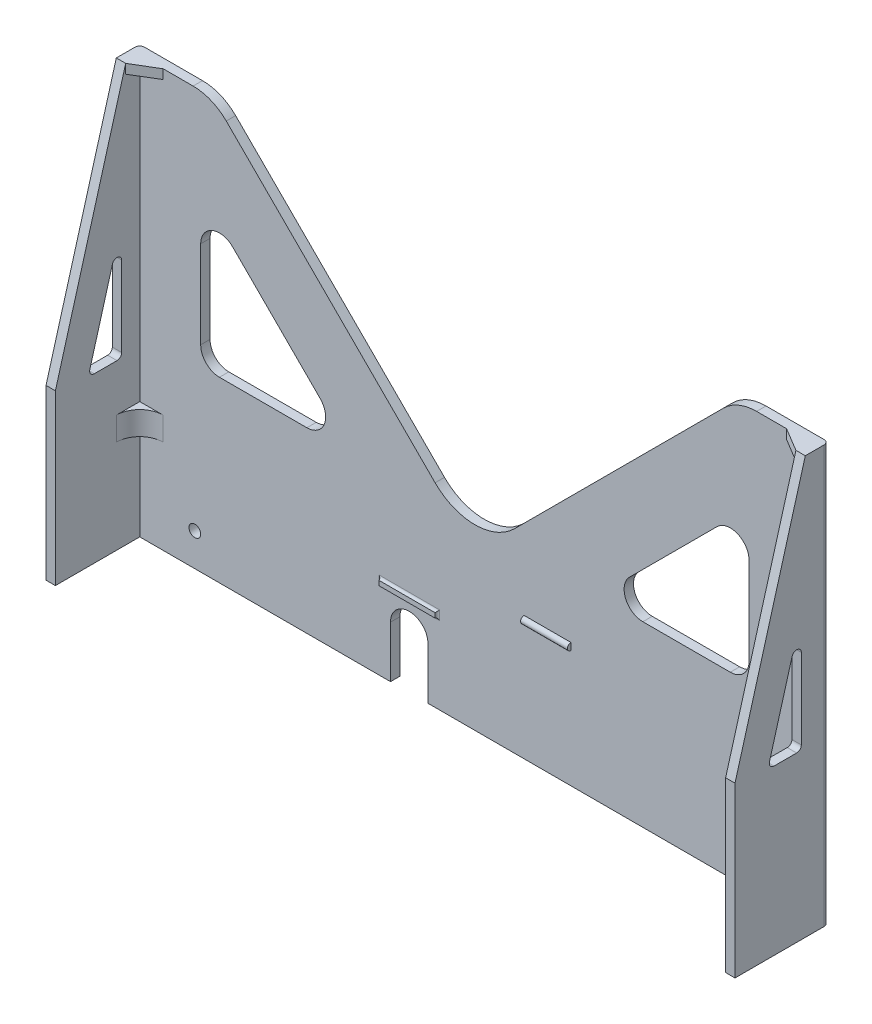
from build123d import *

# Parameters (mm, degrees)
RESSALTO_EXTRUS_O3_DEPTH   = 89
FILETE3_R                  = 1
ESBO_O16_W                 = 12
ESBO_O16_H                 = 1
RESSALTO_EXTRUS_O5_DEPTH   = 0.5
FILETE7_R                  = 0.5
CORTE_EXTRUS_O9_DEPTH      = 200
CORTE_EXTRUS_O9_DEPTH_BACK = 10
ESBO_O22_R                 = 1.25
ESBO_O22_W                 = 8
ESBO_O22_H                 = 15
CORTE_EXTRUS_O10_DEPTH     = 322.757399842
RESSALTO_EXTRUS_O8_DEPTH   = 2
FILETE12_R                 = 10
FILETE13_R                 = 4
ESBO_O30_W                 = 10
ESBO_O30_H                 = 1.5
RESSALTO_EXTRUS_O10_DEPTH  = 0.75
FILETE14_R                 = 0.75
RESSALTO_EXTRUS_O11_START  = -20
RESSALTO_EXTRUS_O11_DEPTH  = 5


with BuildPart() as part:
    # Esboço6 → Ressalto-extrusão3 (new body)
    with BuildSketch(Plane(origin=(0, -284.347629413, 0), x_dir=(1, 0, 0), z_dir=(0, 1, 0))):
        Polygon((4.5, 12.61291239), (2.5, 12.61291239), (2.5, 32.61291239), (149.5, 32.61291239), (149.5, 12.61291239), (147.5, 12.61291239), (147.5, 30.61291239), (4.5, 30.61291239), align=None)
    extrude(amount=RESSALTO_EXTRUS_O3_DEPTH)

    # Filete3
    filete3_edges = [part.edges().sort_by_distance(p)[0] for p in [
        (2.5, -239.847629413, -32.61291239),
        (149.5, -239.847629413, -32.61291239),
    ]]
    fillet(filete3_edges, radius=FILETE3_R)

    # Esboço16 → Ressalto-extrusão5 (add)
    with BuildSketch(Plane.XY.offset(-30.61291239)):
        with Locations((62, -266.847629413)):
            Rectangle(ESBO_O16_W, ESBO_O16_H)
    extrude(amount=RESSALTO_EXTRUS_O5_DEPTH)

    # Filete7
    filete7_edges = [part.edges().sort_by_distance(p)[0] for p in [
        (56, -266.847629413, -30.61291239),
        (68, -266.847629413, -30.61291239),
        (62, -266.347629413, -30.61291239),
        (62, -267.347629413, -30.61291239),
    ]]
    fillet(filete7_edges, radius=FILETE7_R - 0.0001)  # a hair under: the kernel refuses the full size

    # Esboço20 → Corte-extrusão9 (cut, two sides: drawn at the far end of the back side and taken through both)
    with BuildSketch(Plane.ZY.offset(-147.5).offset(-CORTE_EXTRUS_O9_DEPTH_BACK)):
        Polygon((-27.61291239, -195.347629413), (-12.61291239, -195.347629413), (-12.61291239, -248.347629413), align=None)
        with BuildLine():
            Line((-19.964933879, -248.075306948), (-24.796932275, -231.002245945))
            ThreePointArc((-24.796932275, -231.002245945), (-25.896604597, -230.284061963), (-26.759138321, -231.274568411))
            Line((-26.759138321, -231.274568411), (-26.759138321, -248.347629413))
            ThreePointArc((-26.759138321, -248.347629413), (-26.466245102, -249.054736195), (-25.759138321, -249.347629413))
            Line((-25.759138321, -249.347629413), (-20.927139924, -249.347629413))
            ThreePointArc((-20.927139924, -249.347629413), (-20.129542762, -248.950819903), (-19.964933879, -248.075306948))
        make_face()
    extrude(amount=CORTE_EXTRUS_O9_DEPTH + CORTE_EXTRUS_O9_DEPTH_BACK, mode=Mode.SUBTRACT)

    # Esboço22 → Corte-extrusão10 (cut, through all)
    with BuildSketch(Plane.XY.offset(-30.61291239)):
        with Locations((16.25, -277.347629413)):
            Circle(ESBO_O22_R)
        with Locations((135.75, -277.347629413)):
            Circle(ESBO_O22_R)
        with BuildLine():
            Line((131.970562748, -195.347629413), (20.029437252, -195.347629413))
            Line((20.029437252, -195.347629413), (67.514718626, -242.832910788))
            ThreePointArc((67.514718626, -242.832910788), (76, -246.347629413), (84.485281374, -242.832910788))
            Line((84.485281374, -242.832910788), (131.970562748, -195.347629413))
        make_face()
        with BuildLine():
            Line((134.5, -223.688249847), (134.5, -242.347629413))
            ThreePointArc((134.5, -242.347629413), (133.328427125, -245.176056538), (130.5, -246.347629413))
            Line((130.5, -246.347629413), (111.840620434, -246.347629413))
            ThreePointArc((111.840620434, -246.347629413), (108.145102304, -243.878363143), (109.012193309, -239.519202289))
            Line((109.012193309, -239.519202289), (127.671572875, -220.859822722))
            ThreePointArc((127.671572875, -220.859822722), (132.030733729, -219.992731717), (134.5, -223.688249847))
        make_face()
        with BuildLine():
            Line((17.5, -223.688249847), (17.5, -242.347629413))
            ThreePointArc((17.5, -242.347629413), (18.671572875, -245.176056538), (21.5, -246.347629413))
            Line((21.5, -246.347629413), (40.159379566, -246.347629413))
            ThreePointArc((40.159379566, -246.347629413), (43.854897696, -243.878363143), (42.987806691, -239.519202289))
            Line((42.987806691, -239.519202289), (24.328427125, -220.859822722))
            ThreePointArc((24.328427125, -220.859822722), (19.969266271, -219.992731717), (17.5, -223.688249847))
        make_face()
        with Locations((62, -276.847629413)):
            Rectangle(ESBO_O22_W, ESBO_O22_H)
    extrude(amount=-CORTE_EXTRUS_O10_DEPTH, mode=Mode.SUBTRACT)

    # Esboço25 → Ressalto-extrusão8 (add)
    with BuildSketch(Plane(origin=(0, -195.347629413, 0), x_dir=(1, 0, 0), z_dir=(0, 1, 0))):
        Polygon((147.5, 30.61291239), (142.5, 30.61291239), (147.5, 27.61291239), align=None)
        Polygon((4.5, 30.61291239), (9.5, 30.61291239), (4.5, 27.61291239), align=None)
    extrude(amount=-RESSALTO_EXTRUS_O8_DEPTH)

    # Filete12
    filete12_edges = [part.edges().sort_by_distance(p)[0] for p in [
        (20.029437252, -195.347629413, -31.61291239),
        (131.970562748, -195.347629413, -31.61291239),
    ]]
    fillet(filete12_edges, radius=FILETE12_R)

    # Filete13
    filete13_edges = [part.edges().sort_by_distance(p)[0] for p in [
        (58, -269.347629413, -31.61291239),
        (66, -269.347629413, -31.61291239),
    ]]
    fillet(filete13_edges, radius=FILETE13_R - 0.0001)  # a hair under: the kernel refuses the full size

    # Esboço30 → Ressalto-extrusão10 (add)
    with BuildSketch(Plane.XY.offset(-30.61291239)):
        with Locations((91.5, -258.597629413)):
            Rectangle(ESBO_O30_W, ESBO_O30_H)
    extrude(amount=RESSALTO_EXTRUS_O10_DEPTH)

    # Filete14
    filete14_edges = [part.edges().sort_by_distance(p)[0] for p in [
        (91.5, -257.847629413, -29.86291239),
        (91.5, -259.347629413, -29.86291239),
    ]]
    fillet(filete14_edges, radius=FILETE14_R - 0.0001)  # a hair under: the kernel refuses the full size

    # Esboço31 → Ressalto-extrusão11 (add)
    with BuildSketch(Plane.XZ.offset(284.347629413).offset(RESSALTO_EXTRUS_O11_START)):
        with BuildLine():
            Line((147.5, -30.61291239), (142.5, -30.61291239))
            ThreePointArc((142.5, -30.61291239), (146.035533906, -29.148446296), (147.5, -25.61291239))
            Line((147.5, -25.61291239), (147.5, -30.61291239))
        make_face()
        with BuildLine():
            Line((4.5, -30.61291239), (9.5, -30.61291239))
            ThreePointArc((9.5, -30.61291239), (5.964466094, -29.148446296), (4.5, -25.61291239))
            Line((4.5, -25.61291239), (4.5, -30.61291239))
        make_face()
    extrude(amount=-RESSALTO_EXTRUS_O11_DEPTH)


solid = part.part
